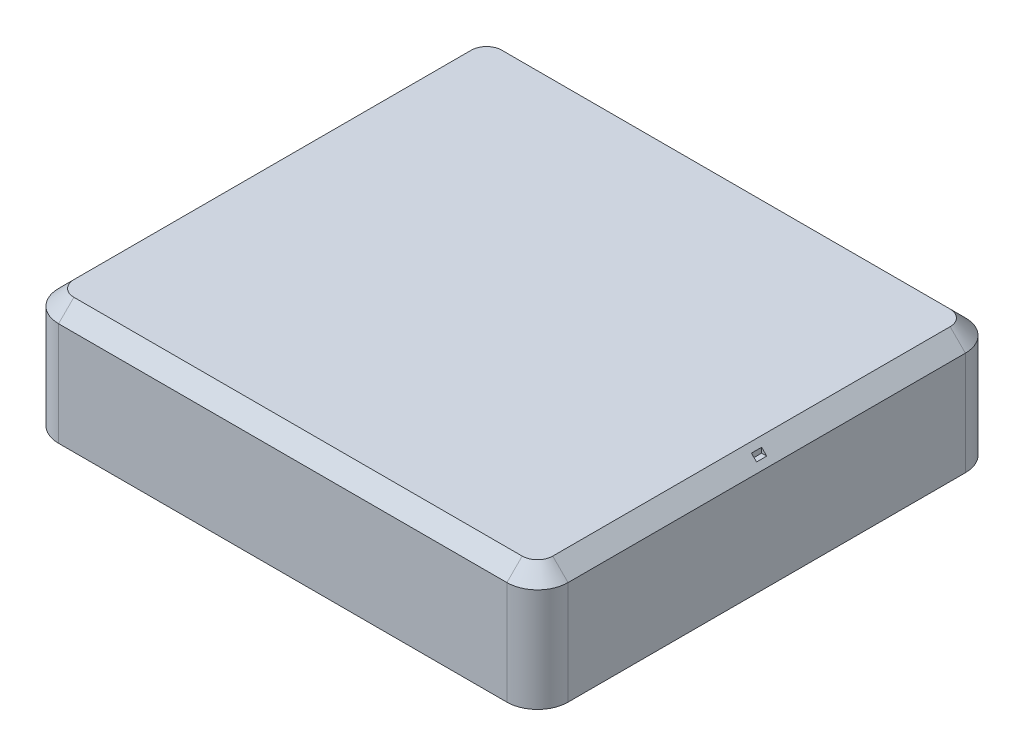
from build123d import *

# Parameters (mm, degrees)
SKETCH1_W           = 50
SKETCH1_H           = 11.666666667
BOSS_EXTRUDE1_DEPTH = 45
SKETCH2_W           = 1
SKETCH2_H           = 1
CUT_EXTRUDE1_DEPTH  = 1
SHELL1_T            = -2.5
SKETCH3_W           = 47.4
SKETCH3_H           = 42.4
SKETCH3_W_2         = 45
SKETCH3_H_2         = 40
CUT_EXTRUDE3_DEPTH  = 2.5
FILLET1_R           = 1
FILLET2_R           = 3
CHAMFER1_SIZE       = 1.5


with BuildPart() as part:
    # Sketch1 → Boss-Extrude1 (new body)
    with BuildSketch(Plane.XY):
        with Locations((25, 5.833333334)):
            Rectangle(SKETCH1_W, SKETCH1_H)
    extrude(amount=BOSS_EXTRUDE1_DEPTH)

    # Sketch2 → Cut-Extrude1 (cut)
    with BuildSketch(Plane(origin=(50, 0, 0), x_dir=(0, 0, -1), z_dir=(1, 0, 0))):
        with Locations((-22.5, 11.166666667)):
            Rectangle(SKETCH2_W, SKETCH2_H)
    extrude(amount=-CUT_EXTRUDE1_DEPTH, mode=Mode.SUBTRACT)

    # Shell1
    shell1_openings = [part.faces().sort_by_distance(p)[0] for p in [
        (25, 0, 22.5),
    ]]
    offset(amount=SHELL1_T, openings=shell1_openings, kind=Kind.INTERSECTION)

    # Sketch3 → Cut-Extrude3 (cut)
    with BuildSketch(Plane.XZ):
        with Locations((25, 22.5)):
            Rectangle(SKETCH3_W, SKETCH3_H)
        with Locations((25, 22.5)):
            Rectangle(SKETCH3_W_2, SKETCH3_H_2, mode=Mode.SUBTRACT)
    extrude(amount=-CUT_EXTRUDE3_DEPTH, mode=Mode.SUBTRACT)

    # Fillet1
    fillet1_edges = [part.edges().sort_by_distance(p)[0] for p in [
        (1.3, 1.25, 1.3),
        (1.3, 1.25, 43.7),
        (48.7, 1.25, 43.7),
        (48.7, 1.25, 1.3),
    ]]
    fillet(fillet1_edges, radius=FILLET1_R)

    # Fillet2
    fillet2_edges = [part.edges().sort_by_distance(p)[0] for p in [
        (50, 5.833333333, 45),
        (0, 5.833333333, 45),
        (50, 5.833333333, 0),
        (0, 5.833333333, 0),
    ]]
    fillet(fillet2_edges, radius=FILLET2_R)

    # Chamfer1
    # the kernel refuses this chamfer: 1.5 mm, written as the material it takes off along each edge
    with BuildSketch(Plane(origin=(50, 11.666666667, 19.142475518), x_dir=(0.027495876610586768, -0.9996219169112968, 0), z_dir=(0, 0, 1)), Plane(origin=(50, 11.666666667, 3), x_dir=(0.027495876610586768, -0.9996219169112968, 0), z_dir=(0, 0, 1))) as chamfer1_piece_1:
        Polygon((CHAMFER1_SIZE * 0.999621916911, -CHAMFER1_SIZE * 0.0274958766106), (-CHAMFER1_SIZE * 0.0274958766106, -CHAMFER1_SIZE * 0.999621916911), (0, 0), align=None)
    extrude(amount=22.857524482, mode=Mode.SUBTRACT)
    with BuildSketch(Plane(origin=(47, 11.666666667, 42), x_dir=(0, 0, 1), z_dir=(-1, 0, 0))) as chamfer1_piece_2:
        Polygon((3, -CHAMFER1_SIZE), (3 - CHAMFER1_SIZE, 0), (3, 0), align=None)
    revolve(axis=Axis((47, 11.666666667, 42), (0, 1, 0)), revolution_arc=90, mode=Mode.SUBTRACT)
    with BuildSketch(Plane(origin=(47, 11.666666667, 3), x_dir=(0, 0, -1), z_dir=(-1, 0, 0))) as chamfer1_piece_3:
        Polygon((3, CHAMFER1_SIZE), (3 - CHAMFER1_SIZE, 0), (3, 0), align=None)
    revolve(axis=Axis((47, 11.666666667, 3), (0, -1, 0)), revolution_arc=90, mode=Mode.SUBTRACT)
    with BuildSketch(Plane(origin=(47, 11.666666667, 45), x_dir=(0, -0.9996219169112965, 0.02749587661058676), z_dir=(-1, 0, 0))) as chamfer1_piece_4:
        Polygon((CHAMFER1_SIZE * 0.999621916911, -CHAMFER1_SIZE * 0.0274958766106), (-CHAMFER1_SIZE * 0.0274958766106, -CHAMFER1_SIZE * 0.999621916911), (0, 0), align=None)
    extrude(amount=44, mode=Mode.SUBTRACT)
    with BuildSketch(Plane(origin=(47, 11.666666667, 0), x_dir=(0, -0.9996219169112968, -0.02749587661058636), z_dir=(-1, 0, 0))) as chamfer1_piece_5:
        Polygon((CHAMFER1_SIZE * 0.999621916911, CHAMFER1_SIZE * 0.0274958766106), (-CHAMFER1_SIZE * 0.0274958766106, CHAMFER1_SIZE * 0.999621916911), (0, 0), align=None)
    extrude(amount=44, mode=Mode.SUBTRACT)
    with BuildSketch(Plane(origin=(3, 11.666666667, 42), x_dir=(-1, 0, 0), z_dir=(0, 0, -1))) as chamfer1_piece_6:
        Polygon((3, -CHAMFER1_SIZE), (3 - CHAMFER1_SIZE, 0), (3, 0), align=None)
    revolve(axis=Axis((3, 11.666666667, 42), (0, 1, 0)), revolution_arc=90, mode=Mode.SUBTRACT)
    with BuildSketch(Plane(origin=(3, 11.666666667, 3), x_dir=(-1, 0, 0), z_dir=(0, 0, 1))) as chamfer1_piece_7:
        Polygon((3, CHAMFER1_SIZE), (3 - CHAMFER1_SIZE, 0), (3, 0), align=None)
    revolve(axis=Axis((3, 11.666666667, 3), (0, -1, 0)), revolution_arc=90, mode=Mode.SUBTRACT)
    with BuildSketch(Plane(origin=(0, 11.666666667, 3), x_dir=(-0.02749587661058636, -0.9996219169112968, 0), z_dir=(0, 0, 1))) as chamfer1_piece_8:
        Polygon((CHAMFER1_SIZE * 0.999621916911, CHAMFER1_SIZE * 0.0274958766106), (-CHAMFER1_SIZE * 0.0274958766106, CHAMFER1_SIZE * 0.999621916911), (0, 0), align=None)
    extrude(amount=39, mode=Mode.SUBTRACT)


solid = part.part
